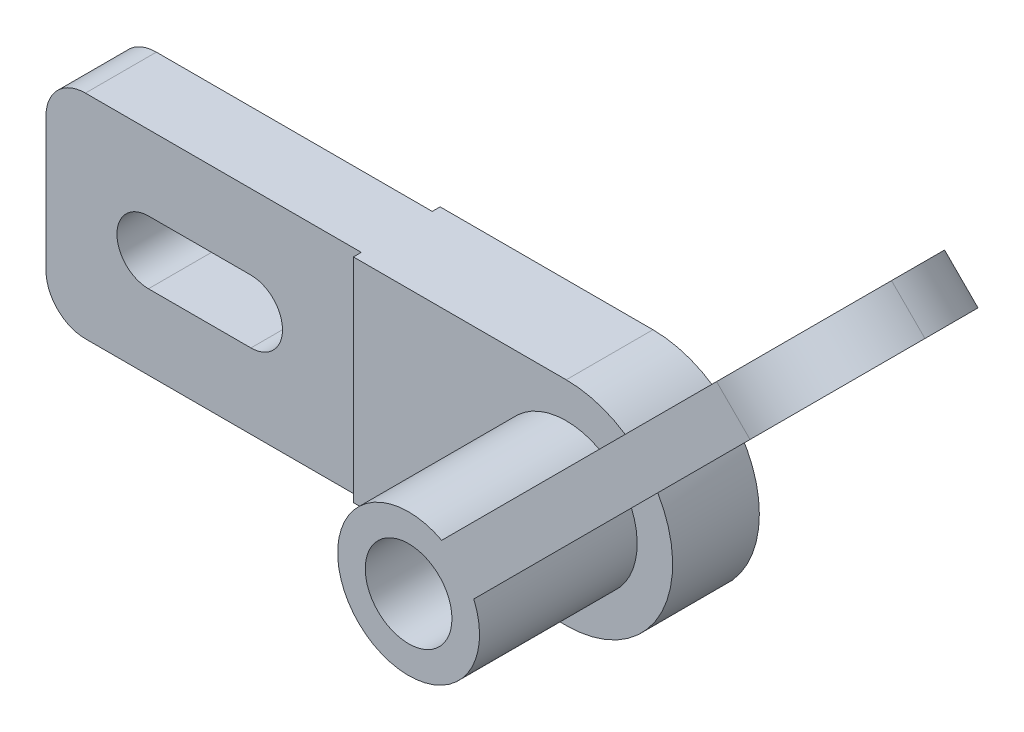
from build123d import *

# Parameters (mm, degrees)
EXTRUDE_1_DEPTH     = 11
CUT_EXTRUDE_1_DEPTH = 15
SKETCH_3_R          = 9
EXTRUDE_2_DEPTH     = 20
SKETCH_4_W          = 40
SKETCH_4_H          = 27
CUT_EXTRUDE_2_DEPTH = 1
SKETCH_6_R          = 5.5
CUT_EXTRUDE_3_DEPTH = 76.048317769
EXTRUDE_3_DEPTH     = 26
FILLET_1_R          = 13
FILLET_2_R          = 5
CUT_EXTRUDE_4_DEPTH = 10


with BuildPart() as part:
    # 스케치1 → 보스-돌출1 (new body)
    with BuildSketch(Plane.XY):
        with BuildLine():
            Line((-67, 13.5), (0, 13.5))
            ThreePointArc((0, 13.5), (13.5, 0), (0, -13.5))
            Line((0, -13.5), (-67, -13.5))
            Line((-67, -13.5), (-67, 13.5))
        make_face()
    extrude(amount=EXTRUDE_1_DEPTH)

    # 스케치2 → 컷-돌출1 (cut)
    with BuildSketch(Plane.XY.offset(11)):
        with BuildLine():
            Line((-54, 4), (-41, 4))
            ThreePointArc((-41, 4), (-37, 0), (-41, -4))
            Line((-41, -4), (-54, -4))
            ThreePointArc((-54, -4), (-58, 0), (-54, 4))
        make_face()
    extrude(amount=-CUT_EXTRUDE_1_DEPTH, mode=Mode.SUBTRACT)

    # 스케치3 → 보스-돌출2 (add)
    with BuildSketch(Plane.XY.offset(11)):
        Circle(SKETCH_3_R)
    extrude(amount=EXTRUDE_2_DEPTH)

    # 스케치4 → 컷-돌출2 (cut)
    with BuildSketch(Plane.XY.offset(11)):
        with Locations((-47, 0)):
            Rectangle(SKETCH_4_W, SKETCH_4_H)
    cut_extrude_2 = extrude(amount=-CUT_EXTRUDE_2_DEPTH, mode=Mode.SUBTRACT)

    # 대칭 복사1: 컷-돌출2 across plane
    add(cut_extrude_2.mirror(Plane.XY.offset(5.5)), mode=Mode.SUBTRACT)

    # 스케치6 → 컷-돌출3 (cut, through all)
    with BuildSketch(Plane.XY.offset(31)):
        Circle(SKETCH_6_R)
    extrude(amount=-CUT_EXTRUDE_3_DEPTH, mode=Mode.SUBTRACT)

    # 스케치8 → 보스-돌출3 (add)
    with BuildSketch(Plane.XY.offset(31)):
        Polygon((48.267141866, 52.030952398), (3.01230787, 6.776118402), (7.254948557, 2.533477715), (52.509782553, 47.788311711), align=None)
    extrude(amount=-EXTRUDE_3_DEPTH)

    # 필렛1
    fillet_1_edges = [part.edges().sort_by_distance(p)[0] for p in [
        (50.38846221, 49.909632055, 31),
        (50.38846221, 49.909632055, 5),
    ]]
    fillet(fillet_1_edges, radius=FILLET_1_R - 0.0001)  # a hair under: the kernel refuses the full size

    # 필렛2
    fillet_2_edges = [part.edges().sort_by_distance(p)[0] for p in [
        (-67, -13.5, 5.5),
        (-67, 13.5, 5.5),
    ]]
    fillet(fillet_2_edges, radius=FILLET_2_R)

    # 스케치11 → 컷-돌출4 (cut)
    with BuildSketch(Plane(origin=(2.360735421, -2.360735421, 0), x_dir=(0, 0, -1), z_dir=(0.7071067811865477, -0.7071067811865475, 0))):
        with BuildLine():
            Line((-14, 58), (-14, 30))
            ThreePointArc((-14, 30), (-18, 26), (-22, 30))
            Line((-22, 30), (-22, 58))
            ThreePointArc((-22, 58), (-18, 62), (-14, 58))
        make_face()
    extrude(amount=-CUT_EXTRUDE_4_DEPTH, mode=Mode.SUBTRACT)


solid = part.part
